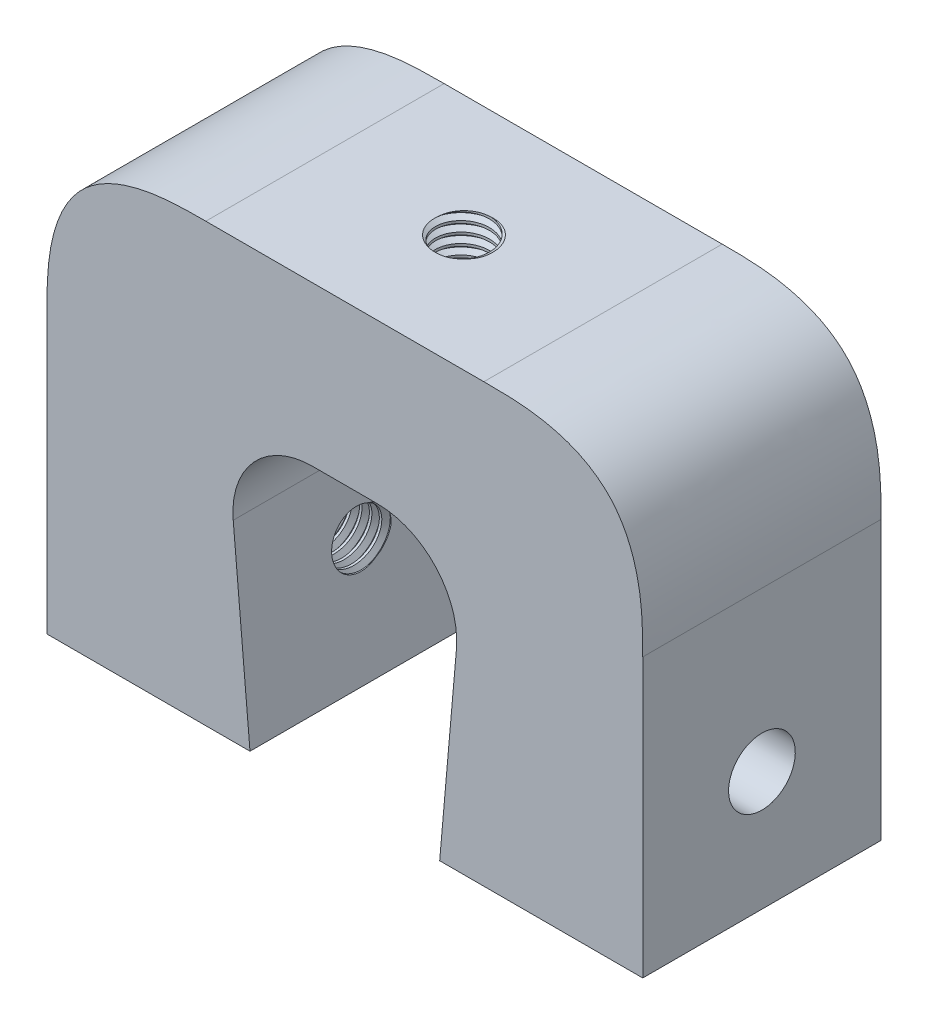
from build123d import *

# Parameters (mm, degrees)
BOSS_EXTRUDE1_DEPTH = 30
FILLET2_SIZE        = 20
FILLET3_R           = 10
CUT_EXTRUDE1_REACH  = 87.33
SKETCH13_R          = 3.4
SKETCH14_R          = 4.2
CUT_EXTRUDE2_DEPTH  = 15
THREAD2_PITCH       = 1.25
THREAD3_PITCH       = 1.25
SKETCH21_R          = 3.4
CUT_EXTRUDE3_DEPTH  = 15
THREAD4_PITCH       = 1.25
THREAD4_TO          = 20


with BuildPart() as part:
    # Sketch2 → Boss-Extrude1 (new body)
    with BuildSketch(Plane.XY):
        Polygon((11.937896777, -27.5), (37.5, -27.5), (37.5, 27.5), (-37.5, 27.5), (-37.5, -27.5), (-11.937896777, -27.5), (-15, 7.5), (15, 7.5), align=None)
    extrude(amount=BOSS_EXTRUDE1_DEPTH)

    # Fillet2
    # a fillet whose section is not a circle: 20 mm, written as the material it takes off along each edge
    with BuildSketch(Plane(origin=(37.5, 27.5, -50), x_dir=(0, -1, 0), z_dir=(0, 0, 1)), Plane(origin=(-37.5, 27.5, -50), x_dir=(1, 0, 0), z_dir=(0, 0, 1))) as fillet2_piece_1:
        with BuildLine():
            add(Edge.make_bspline([(FILLET2_SIZE, 0), (FILLET2_SIZE * 0.831801948466, 0), (FILLET2_SIZE * 0.663603896932, 0), (FILLET2_SIZE * 0.292893218813, -FILLET2_SIZE * 0.0716919198361), (FILLET2_SIZE * 0.0716919198361, -FILLET2_SIZE * 0.292893218813), (0, -FILLET2_SIZE * 0.663603896932), (0, -FILLET2_SIZE * 0.831801948466), (0, -FILLET2_SIZE)], knots=[0, 0, 0, 0, 0, 0, 0.5, 0.5, 1, 1, 1, 1, 1, 1], degree=5))
            Line((0, -FILLET2_SIZE), (0, 0))
            Line((0, 0), (FILLET2_SIZE, 0))
        make_face()
    extrude(amount=130, mode=Mode.SUBTRACT)

    # Fillet3
    fillet3_edges = [part.edges().sort_by_distance(p)[0] for p in [
        (15, 7.5, 15),
        (-15, 7.5, 15),
    ]]
    fillet(fillet3_edges, radius=FILLET3_R)

    # Cut-Extrude1: up to this plane
    cut_extrude1_end = Plane(origin=(11.937896777, -27.5, 30), z_dir=(0.9961946980917462, -0.08715574274765119, 0))
    # Sketch13 → Cut-Extrude1 (cut, up to the surface)
    with BuildSketch(Plane(origin=(37.5, 0, 0), x_dir=(0, 0, -1), z_dir=(1, 0, 0)), mode=Mode.PRIVATE) as cut_extrude1_sk1:
        with Locations(Location((-15, -12.5, 0), (0, 0, 90))):
            Circle(SKETCH13_R)
    cut_extrude1_tool1 = split(extrude(cut_extrude1_sk1.sketch, amount=-CUT_EXTRUDE1_REACH, mode=Mode.PRIVATE), bisect_by=cut_extrude1_end, keep=Keep.BOTH, mode=Mode.PRIVATE)
    cut_extrude1 = cut_extrude1_tool1.solids().sort_by_distance((37.5, -12.5, 15))[0]
    add(cut_extrude1, mode=Mode.SUBTRACT)

    # Sketch14 → Cut-Extrude2 (cut)
    with BuildSketch(Plane(origin=(37.5, 0, 0), x_dir=(0, 0, -1), z_dir=(1, 0, 0))):
        with Locations(Location((-15, -12.5, 0), (0, 0, 90))):
            Circle(SKETCH14_R)
    cut_extrude2 = extrude(amount=-CUT_EXTRUDE2_DEPTH, mode=Mode.SUBTRACT)

    # Thread2: arcs per turn and ends read off the stored shape
    # Thread2: the profile of Thread Profile2 profile screwed along a right-hand helix through 16 turns, 8 arcs to a turn; built about Z, then put on its axis
    thread2_z = Axis((0, 0, 0), (0, 0, 1))
    thread2_corners = [(3.3997, 0, -0.000173205), (4.076582344, 0, 0.390624998), (4.076582344, 0, 0.546874998), (3.3997, 0, 0.937673202)]
    with BuildLine(mode=Mode.PRIVATE) as thread2_profile:
        Line(thread2_corners[0], thread2_corners[1])
        Line(thread2_corners[1], thread2_corners[2])
        Line(thread2_corners[2], thread2_corners[3])
        Line(thread2_corners[3], thread2_corners[0])
    thread2_cap = Face(thread2_profile.wire())
    thread2_turn_angles = [0, 22.5, 45, 67.5, 90, 112.5, 135, 157.5, 180, 202.5, 225, 247.5, 270, 292.5, 315, 337.5, 360]
    thread2_turn_weights = [1, 0.9238795325112867, 1, 0.9238795325112867, 1, 0.9238795325112867, 1, 0.9238795325112867, 1, 0.9238795325112867, 1, 0.9238795325112867, 1, 0.9238795325112867, 1, 0.9238795325112867, 1]
    thread2_turn_rails = [Edge.make_bspline([Vector(p[0], p[1], 0).rotate(thread2_z, thread2_turn_angles[k]) / thread2_turn_weights[k] + Vector(0, 0, p[2] + THREAD2_PITCH * thread2_turn_angles[k] / 360) for k in range(17)], [0, 0, 0, 1, 1, 2, 2, 3, 3, 4, 4, 5, 5, 6, 6, 7, 7, 8, 8, 8], 2, thread2_turn_weights) for p in thread2_corners]
    thread2_turn_sides = [Face.make_surface_from_curves(thread2_turn_rails[p[0]], thread2_turn_rails[p[1]]) for p in [(0, 1), (1, 2), (2, 3), (3, 0)]]
    thread2 = Plane(origin=(27.5, -12.5, 15), x_dir=(0, 0, 1), z_dir=(-1, 0, 0)) * Solid(Shell([*[p.moved(Location((0, 0, THREAD2_PITCH * i))) for i in range(16) for p in thread2_turn_sides], thread2_cap, thread2_cap.rotate(thread2_z, 5760).moved(Location((0, 0, THREAD2_PITCH * 5760 / 360)))]))
    add(thread2, mode=Mode.SUBTRACT)

    # Mirror2: Cut-Extrude1, Cut-Extrude2 across plane
    add(cut_extrude1.mirror(Plane(origin=(0, 0, 0), x_dir=(0, 0, 1), z_dir=(1, 0, 0))), mode=Mode.SUBTRACT)
    add(cut_extrude2.mirror(Plane(origin=(0, 0, 0), x_dir=(0, 0, 1), z_dir=(1, 0, 0))), mode=Mode.SUBTRACT)

    # Thread3: arcs per turn and ends read off the stored shape
    # Thread3: the profile of Thread Profile3 profile screwed along a right-hand helix through 16 turns, 8 arcs to a turn; built about Z, then put on its axis
    thread3_z = Axis((0, 0, 0), (0, 0, 1))
    thread3_corners = [(3.3997, 0, -0.000173205), (4.076582344, 0, 0.390624998), (4.076582344, 0, 0.546874998), (3.3997, 0, 0.937673202)]
    with BuildLine(mode=Mode.PRIVATE) as thread3_profile:
        Line(thread3_corners[0], thread3_corners[1])
        Line(thread3_corners[1], thread3_corners[2])
        Line(thread3_corners[2], thread3_corners[3])
        Line(thread3_corners[3], thread3_corners[0])
    thread3_cap = Face(thread3_profile.wire())
    thread3_turn_angles = [0, 22.5, 45, 67.5, 90, 112.5, 135, 157.5, 180, 202.5, 225, 247.5, 270, 292.5, 315, 337.5, 360]
    thread3_turn_weights = [1, 0.9238795325112867, 1, 0.9238795325112867, 1, 0.9238795325112867, 1, 0.9238795325112867, 1, 0.9238795325112867, 1, 0.9238795325112867, 1, 0.9238795325112867, 1, 0.9238795325112867, 1]
    thread3_turn_rails = [Edge.make_bspline([Vector(p[0], p[1], 0).rotate(thread3_z, thread3_turn_angles[k]) / thread3_turn_weights[k] + Vector(0, 0, p[2] + THREAD3_PITCH * thread3_turn_angles[k] / 360) for k in range(17)], [0, 0, 0, 1, 1, 2, 2, 3, 3, 4, 4, 5, 5, 6, 6, 7, 7, 8, 8, 8], 2, thread3_turn_weights) for p in thread3_corners]
    thread3_turn_sides = [Face.make_surface_from_curves(thread3_turn_rails[p[0]], thread3_turn_rails[p[1]]) for p in [(0, 1), (1, 2), (2, 3), (3, 0)]]
    thread3 = Plane(origin=(-27.5, -12.5, 15), x_dir=(0, 0, -1), z_dir=(1, 0, 0)) * Solid(Shell([*[p.moved(Location((0, 0, THREAD3_PITCH * i))) for i in range(16) for p in thread3_turn_sides], thread3_cap, thread3_cap.rotate(thread3_z, 5760).moved(Location((0, 0, THREAD3_PITCH * 5760 / 360)))]))
    add(thread3, mode=Mode.SUBTRACT)

    # Sketch21 → Cut-Extrude3 (cut)
    with BuildSketch(Plane(origin=(0, 27.5, 0), x_dir=(1, 0, 0), z_dir=(0, 1, 0))):
        with Locations(Location((0, -15, 0), (0, 0, 270))):
            Circle(SKETCH21_R)
    extrude(amount=-CUT_EXTRUDE3_DEPTH, mode=Mode.SUBTRACT)

    # Thread4: arcs per turn and ends read off the stored shape
    # Thread4: the profile of Thread Profile4 profile screwed along a right-hand helix through 16 turns, 8 arcs to a turn; built about Z, then put on its axis
    thread4_z = Axis((0, 0, 0), (0, 0, 1))
    thread4_corners = [(3.3997, 0, -0.000173205), (4.076582344, 0, 0.390624998), (4.076582344, 0, 0.546874998), (3.3997, 0, 0.937673202)]
    with BuildLine(mode=Mode.PRIVATE) as thread4_profile:
        Line(thread4_corners[0], thread4_corners[1])
        Line(thread4_corners[1], thread4_corners[2])
        Line(thread4_corners[2], thread4_corners[3])
        Line(thread4_corners[3], thread4_corners[0])
    thread4_cap = Face(thread4_profile.wire())
    thread4_turn_angles = [0, 22.5, 45, 67.5, 90, 112.5, 135, 157.5, 180, 202.5, 225, 247.5, 270, 292.5, 315, 337.5, 360]
    thread4_turn_weights = [1, 0.9238795325112867, 1, 0.9238795325112867, 1, 0.9238795325112867, 1, 0.9238795325112867, 1, 0.9238795325112867, 1, 0.9238795325112867, 1, 0.9238795325112867, 1, 0.9238795325112867, 1]
    thread4_turn_rails = [Edge.make_bspline([Vector(p[0], p[1], 0).rotate(thread4_z, thread4_turn_angles[k]) / thread4_turn_weights[k] + Vector(0, 0, p[2] + THREAD4_PITCH * thread4_turn_angles[k] / 360) for k in range(17)], [0, 0, 0, 1, 1, 2, 2, 3, 3, 4, 4, 5, 5, 6, 6, 7, 7, 8, 8, 8], 2, thread4_turn_weights) for p in thread4_corners]
    thread4_turn_sides = [Face.make_surface_from_curves(thread4_turn_rails[p[0]], thread4_turn_rails[p[1]]) for p in [(0, 1), (1, 2), (2, 3), (3, 0)]]
    thread4 = Plane(origin=(0, 32.5, 15), x_dir=(-1, 0, 0), z_dir=(0, -1, 0)) * split(Solid(Shell([*[p.moved(Location((0, 0, THREAD4_PITCH * i))) for i in range(16) for p in thread4_turn_sides], thread4_cap, thread4_cap.rotate(thread4_z, 5760).moved(Location((0, 0, THREAD4_PITCH * 5760 / 360)))])), bisect_by=Plane.XY.offset(THREAD4_TO), keep=Keep.BOTTOM, mode=Mode.PRIVATE)
    add(thread4, mode=Mode.SUBTRACT)


solid = part.part
